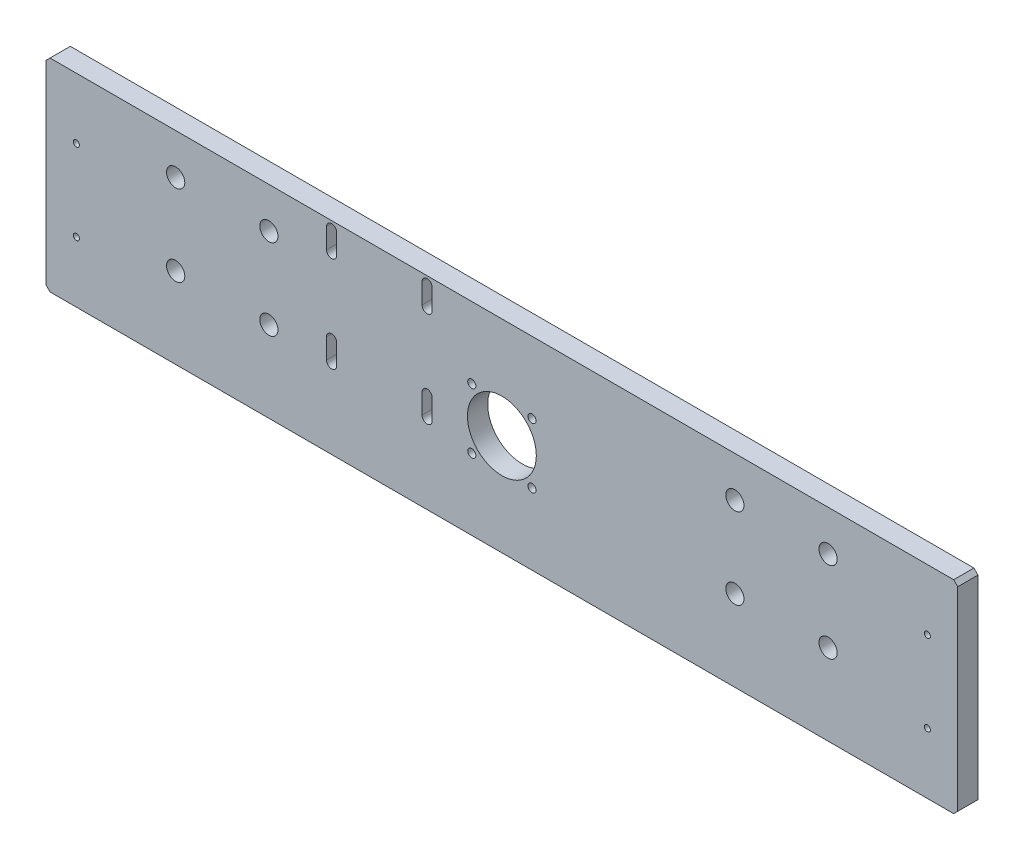
from build123d import *

# Parameters (mm, degrees)
SCHIZZO1_R          = 17
SCHIZZO1_R_2        = 2
SCHIZZO1_R_3        = 4.5
SCHIZZO1_R_4        = 1.5
BOSS_EXTRUDE1_DEPTH = 10
CUT_EXTRUDE1_DEPTH  = 462.085675336


with BuildPart() as part:
    # Schizzo1 → Boss-Extrude1 (new body)
    with BuildSketch(Plane.XY):
        Polygon((2, 0), (448, 0), (450, 2), (450, 98), (448, 100), (2, 100), (0, 98), (0, 2), align=None)
        with Locations((225, 50)):
            Circle(SCHIZZO1_R, mode=Mode.SUBTRACT)
        with Locations((239.849242405, 64.849242405)):
            Circle(SCHIZZO1_R_2, mode=Mode.SUBTRACT)
        with Locations((239.849242405, 35.150757595)):
            Circle(SCHIZZO1_R_2, mode=Mode.SUBTRACT)
        with Locations((210.150757595, 35.150757595)):
            Circle(SCHIZZO1_R_2, mode=Mode.SUBTRACT)
        with Locations((386, 40)):
            Circle(SCHIZZO1_R_3, mode=Mode.SUBTRACT)
        with Locations((386, 80)):
            Circle(SCHIZZO1_R_3, mode=Mode.SUBTRACT)
        with Locations((340, 40)):
            Circle(SCHIZZO1_R_3, mode=Mode.SUBTRACT)
        with Locations((340, 80)):
            Circle(SCHIZZO1_R_3, mode=Mode.SUBTRACT)
        with Locations((435, 70)):
            Circle(SCHIZZO1_R_4, mode=Mode.SUBTRACT)
        with Locations((435, 30)):
            Circle(SCHIZZO1_R_4, mode=Mode.SUBTRACT)
        with Locations((15, 30)):
            Circle(SCHIZZO1_R_4, mode=Mode.SUBTRACT)
        with Locations((210.150757595, 64.849242405)):
            Circle(SCHIZZO1_R_2, mode=Mode.SUBTRACT)
        with Locations((15, 70)):
            Circle(SCHIZZO1_R_4, mode=Mode.SUBTRACT)
        with Locations((110, 80)):
            Circle(SCHIZZO1_R_3, mode=Mode.SUBTRACT)
        with Locations((110, 40)):
            Circle(SCHIZZO1_R_3, mode=Mode.SUBTRACT)
        with Locations((64, 80)):
            Circle(SCHIZZO1_R_3, mode=Mode.SUBTRACT)
        with Locations((64, 40)):
            Circle(SCHIZZO1_R_3, mode=Mode.SUBTRACT)
    extrude(amount=-BOSS_EXTRUDE1_DEPTH)

    # Sketch1 → Cut-Extrude1 (cut, through all)
    with BuildSketch(Plane(origin=(0, 0, -10), x_dir=(-1, 0, 0), z_dir=(0, 0, -1))):
        with BuildLine():
            Line((-190.601221797, 86.248429302), (-190.601221797, 96.248429302))
            ThreePointArc((-190.601221797, 96.248429302), (-188.101221797, 98.748429302), (-185.601221797, 96.248429302))
            Line((-185.601221797, 96.248429302), (-185.601221797, 86.248429302))
            ThreePointArc((-185.601221797, 86.248429302), (-188.101221797, 83.748429302), (-190.601221797, 86.248429302))
        make_face()
        with BuildLine():
            Line((-143.461221797, 86.248429302), (-143.461221797, 96.248429302))
            ThreePointArc((-143.461221797, 96.248429302), (-140.961221797, 98.748429302), (-138.461221797, 96.248429302))
            Line((-138.461221797, 96.248429302), (-138.461221797, 86.248429302))
            ThreePointArc((-138.461221797, 86.248429302), (-140.961221797, 83.748429302), (-143.461221797, 86.248429302))
        make_face()
        with BuildLine():
            Line((-190.601221797, 39.108429302), (-190.601221797, 49.108429302))
            ThreePointArc((-190.601221797, 49.108429302), (-188.101221797, 51.608429302), (-185.601221797, 49.108429302))
            Line((-185.601221797, 49.108429302), (-185.601221797, 39.108429302))
            ThreePointArc((-185.601221797, 39.108429302), (-188.101221797, 36.608429302), (-190.601221797, 39.108429302))
        make_face()
        with BuildLine():
            Line((-143.461221797, 39.108429302), (-143.461221797, 49.108429302))
            ThreePointArc((-143.461221797, 49.108429302), (-140.961221797, 51.608429302), (-138.461221797, 49.108429302))
            Line((-138.461221797, 49.108429302), (-138.461221797, 39.108429302))
            ThreePointArc((-138.461221797, 39.108429302), (-140.961221797, 36.608429302), (-143.461221797, 39.108429302))
        make_face()
    extrude(amount=-CUT_EXTRUDE1_DEPTH, mode=Mode.SUBTRACT)


solid = part.part
